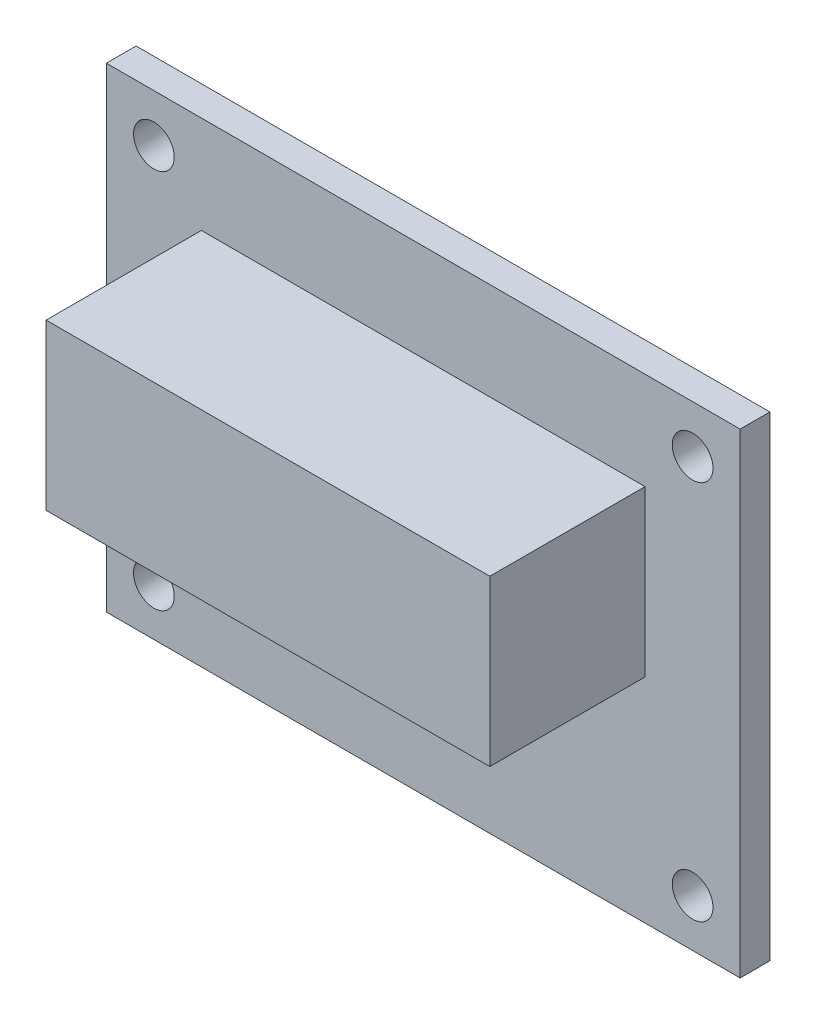
from build123d import *

# Parameters (mm, degrees)
SKETCH1_W           = 50.8
SKETCH1_H           = 38.1
BOSS_EXTRUDE1_DEPTH = 2.38125
SKETCH2_W           = 35.56
SKETCH2_H           = 13.208
BOSS_EXTRUDE2_DEPTH = 12.446


with BuildPart() as part:
    # Sketch1 → Boss-Extrude1 (new body)
    with BuildSketch(Plane.XY):
        Rectangle(SKETCH1_W, SKETCH1_H)
    extrude(amount=BOSS_EXTRUDE1_DEPTH)

    # Sketch5 → #4 Clearance Hole1 (revolve, cut)
    with BuildSketch(Plane(origin=(-21.59, 15.24, 2.38125), x_dir=(0, -1, 0), z_dir=(1, 0, 0))):
        Polygon((0, 0), (0, 4.155574487), (1.63195, 3.175), (1.63195, 0), align=None)
    f_4_clearance_hole1 = revolve(axis=Axis((-21.59, 15.24, 8.73125), (0, 0, -1)), mode=Mode.SUBTRACT)

    # Mirror1: #4 Clearance Hole1 across plane
    add(f_4_clearance_hole1.mirror(Plane(origin=(0, 0, 0), x_dir=(0, 0, 1), z_dir=(1, 0, 0))), mode=Mode.SUBTRACT)

    # Mirror2 copy 1 sketch → Mirror2 copy 1 (revolve, cut)
    with BuildSketch(Plane(origin=(21.59, -15.24, 2.38125), x_dir=(0, 1, 0), z_dir=(-1, 0, 0))):
        Polygon((0, 0), (0, 4.155574487), (1.63195, 3.175), (1.63195, 0), align=None)
    revolve(axis=Axis((21.59, -15.24, 8.73125), (0, 0, -1)), mode=Mode.SUBTRACT)

    # Mirror2 copy 2 sketch → Mirror2 copy 2 (revolve, cut)
    with BuildSketch(Plane(origin=(-21.59, -15.24, 2.38125), x_dir=(0, 1, 0), z_dir=(1, 0, 0))):
        Polygon((0, 0), (0, -4.155574487), (1.63195, -3.175), (1.63195, 0), align=None)
    revolve(axis=Axis((-21.59, -15.24, 8.73125), (0, 0, 1)), mode=Mode.SUBTRACT)

    # Sketch2 → Boss-Extrude2 (add)
    with BuildSketch(Plane.XY.offset(2.38125)):
        with Locations((0, 4.643617701)):
            Rectangle(SKETCH2_W, SKETCH2_H)
    extrude(amount=BOSS_EXTRUDE2_DEPTH)


solid = part.part
